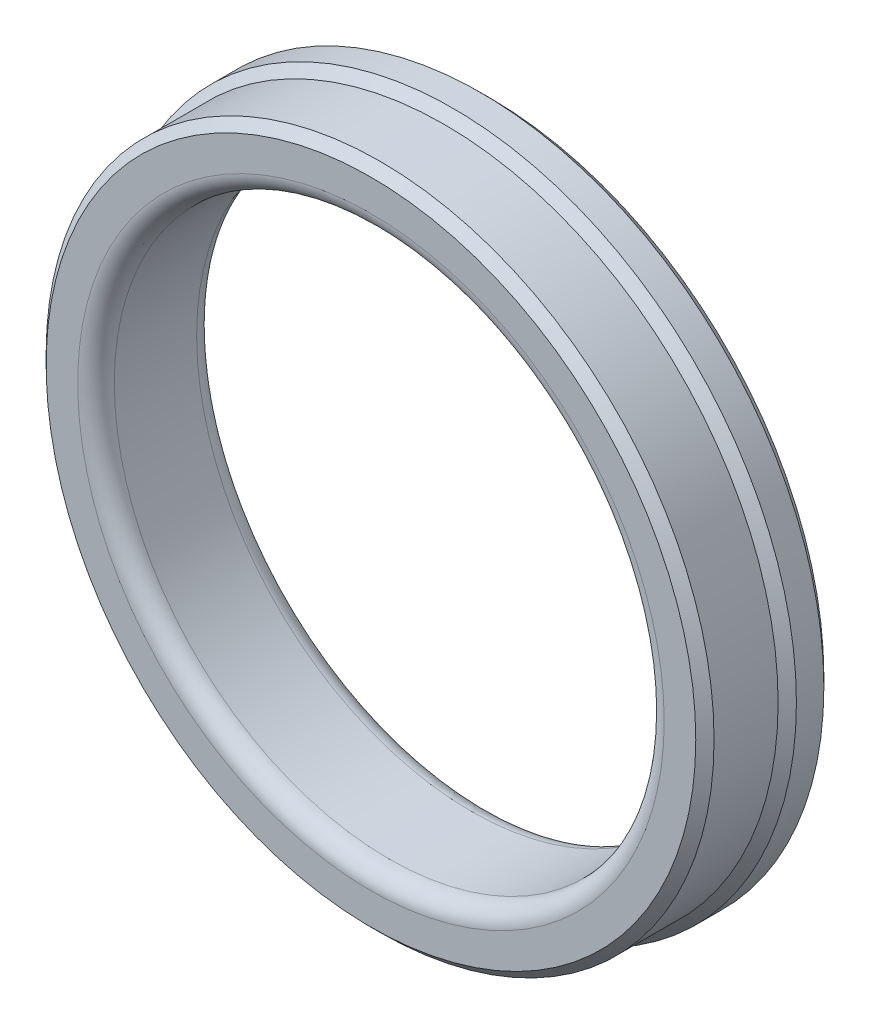
from build123d import *

# Parameters (mm, degrees)
SKETCH1_R           = 37.5
SKETCH1_R_2         = 30.05
BOSS_EXTRUDE1_DEPTH = 5
SKETCH2_R           = 36.5
SKETCH2_R_2         = 30.05
BOSS_EXTRUDE2_DEPTH = 8
CHAMFER1_SIZE       = 1
FILLET1_R           = 2


with BuildPart() as part:
    # Sketch1 → Boss-Extrude1 (new body)
    with BuildSketch(Plane.XY):
        Circle(SKETCH1_R)
        Circle(SKETCH1_R_2, mode=Mode.SUBTRACT)
    extrude(amount=BOSS_EXTRUDE1_DEPTH)

    # Sketch2 → Boss-Extrude2 (add)
    with BuildSketch(Plane.XY.offset(5)):
        Circle(SKETCH2_R)
        Circle(SKETCH2_R_2, mode=Mode.SUBTRACT)
    extrude(amount=BOSS_EXTRUDE2_DEPTH)

    # Chamfer1
    chamfer1_edges = [part.edges().sort_by_distance(p)[0] for p in [
        (-36.5, 0, 13),
        (-37.5, 0, 0),
        (-37.5, 0, 5),
    ]]
    chamfer(chamfer1_edges, length=CHAMFER1_SIZE - 0.0001)  # a hair under: the kernel refuses the full size

    # Fillet1
    fillet1_edges = [part.edges().sort_by_distance(p)[0] for p in [
        (-30.05, 0, 13),
        (-30.05, 0, 0),
    ]]
    fillet(fillet1_edges, radius=FILLET1_R)


solid = part.part
